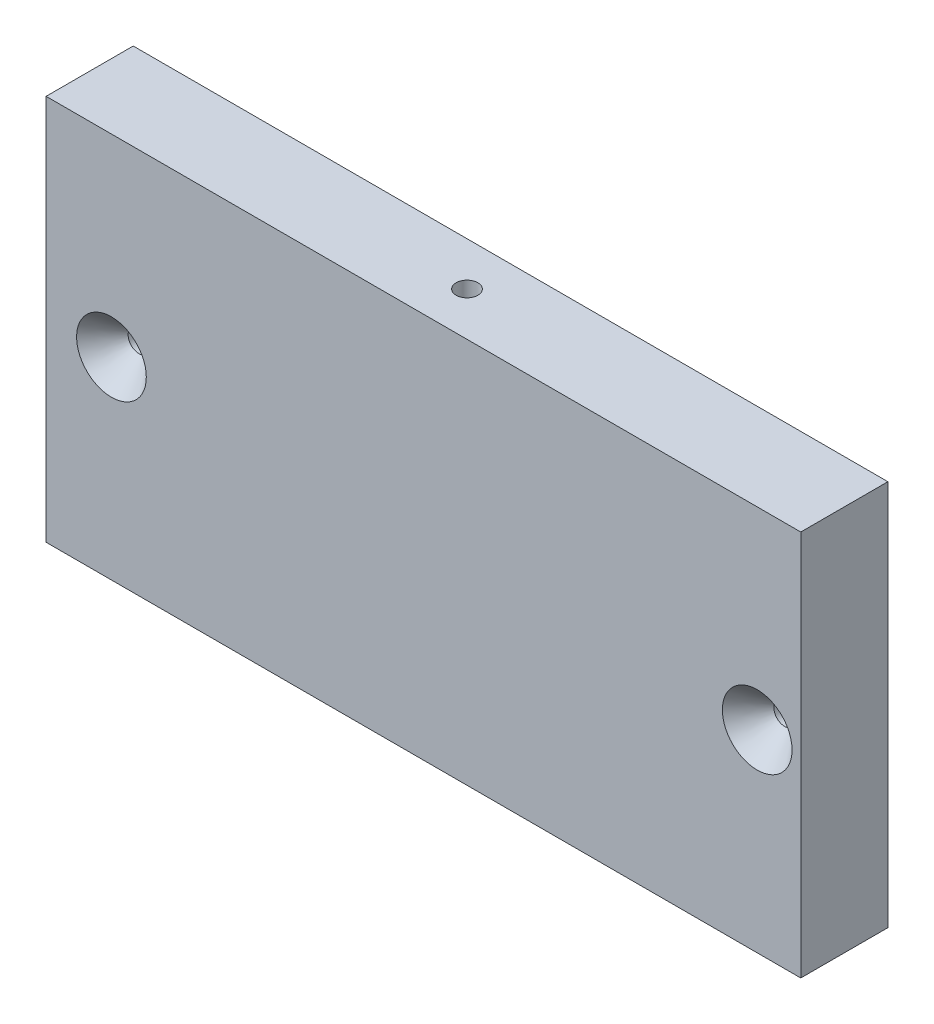
from build123d import *

# Parameters (mm, degrees)
SKETCH2_W           = 110
SKETCH2_H           = 56.3
BOSS_EXTRUDE1_DEPTH = 12.7
HOLE_D              = 3.175
HOLE_DEPTH          = 31.75
HOLE_CSINK_D        = 10.16
HOLE_CSINK_ANGLE    = 82
HOLE_TIP            = 0.953866233
HOLE1_D             = 3.175
HOLE1_DEPTH         = 31.75
HOLE1_CSINK_D       = 10.16
HOLE1_CSINK_ANGLE   = 82
HOLE1_TIP           = 0.953866233


with BuildPart() as part:
    # Sketch2 → Boss-Extrude1 (new body)
    with BuildSketch(Plane.XY):
        with Locations((-286.304465963, 40.85)):
            Rectangle(SKETCH2_W, SKETCH2_H)
    extrude(amount=-BOSS_EXTRUDE1_DEPTH)

    # Hole
    with Locations(Plane(origin=(-124.004465969, 277.286738577, 0), x_dir=(-1, 0, 0), z_dir=(0, 0, 1))):
        with Locations((113.649999994, 236.436738577), (207.774999994, 236.436738577)):
            CounterSinkHole(HOLE_D / 2, HOLE_CSINK_D / 2, depth=HOLE_DEPTH, counter_sink_angle=HOLE_CSINK_ANGLE)
            with Locations((0, 0, -(HOLE_DEPTH + HOLE_TIP / 2))):  # 118° drill point
                Cone(0, HOLE_D / 2, HOLE_TIP, mode=Mode.SUBTRACT)

    # Hole1
    with Locations(Plane(origin=(-124.004465969, 88.05, -103.875709941), x_dir=(1, 0, 0), z_dir=(0, 1, 0))):
        with Locations((-162.299999994, -97.525709941), (-113.649999994, -38.742376608), (-113.649999994, 13.690956725), (162.299999994, -97.525709941), (113.649999994, -38.742376608), (113.649999994, 13.690956725), (63.85, 72.474290059), (0, 72.474290059), (-63.85, 72.474290059)):
            CounterSinkHole(HOLE1_D / 2, HOLE1_CSINK_D / 2, depth=HOLE1_DEPTH, counter_sink_angle=HOLE1_CSINK_ANGLE)
            with Locations((0, 0, -(HOLE1_DEPTH + HOLE1_TIP / 2))):  # 118° drill point
                Cone(0, HOLE1_D / 2, HOLE1_TIP, mode=Mode.SUBTRACT)


solid = part.part
